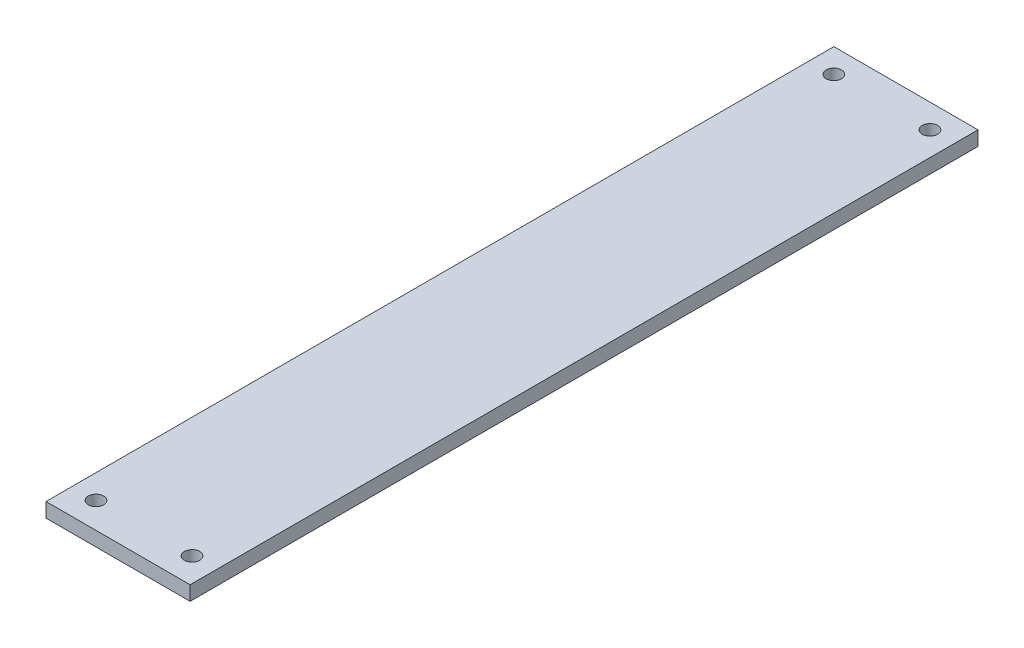
from build123d import *

# Parameters (mm, degrees)
SKETCH1_W           = 30
SKETCH1_H           = 164
BOSS_EXTRUDE1_DEPTH = 3
SKETCH2_R           = 1.6
CUT_EXTRUDE1_DEPTH  = 10


with BuildPart() as part:
    # Sketch1 → Boss-Extrude1 (new body)
    with BuildSketch(Plane(origin=(0, 0, 0), x_dir=(1, 0, 0), z_dir=(0, 1, 0))):
        with Locations((15, 82)):
            Rectangle(SKETCH1_W, SKETCH1_H)
    extrude(amount=BOSS_EXTRUDE1_DEPTH)

    # Sketch2 → Cut-Extrude1 (cut)
    with BuildSketch(Plane(origin=(0, 3, 0), x_dir=(1, 0, 0), z_dir=(0, 1, 0))):
        with Locations((25, 159)):
            Circle(SKETCH2_R)
        with Locations((25, 5.4)):
            Circle(SKETCH2_R)
        with Locations((5, 159)):
            Circle(SKETCH2_R)
        with Locations((5, 5.4)):
            Circle(SKETCH2_R)
    extrude(amount=-CUT_EXTRUDE1_DEPTH, mode=Mode.SUBTRACT)


solid = part.part
